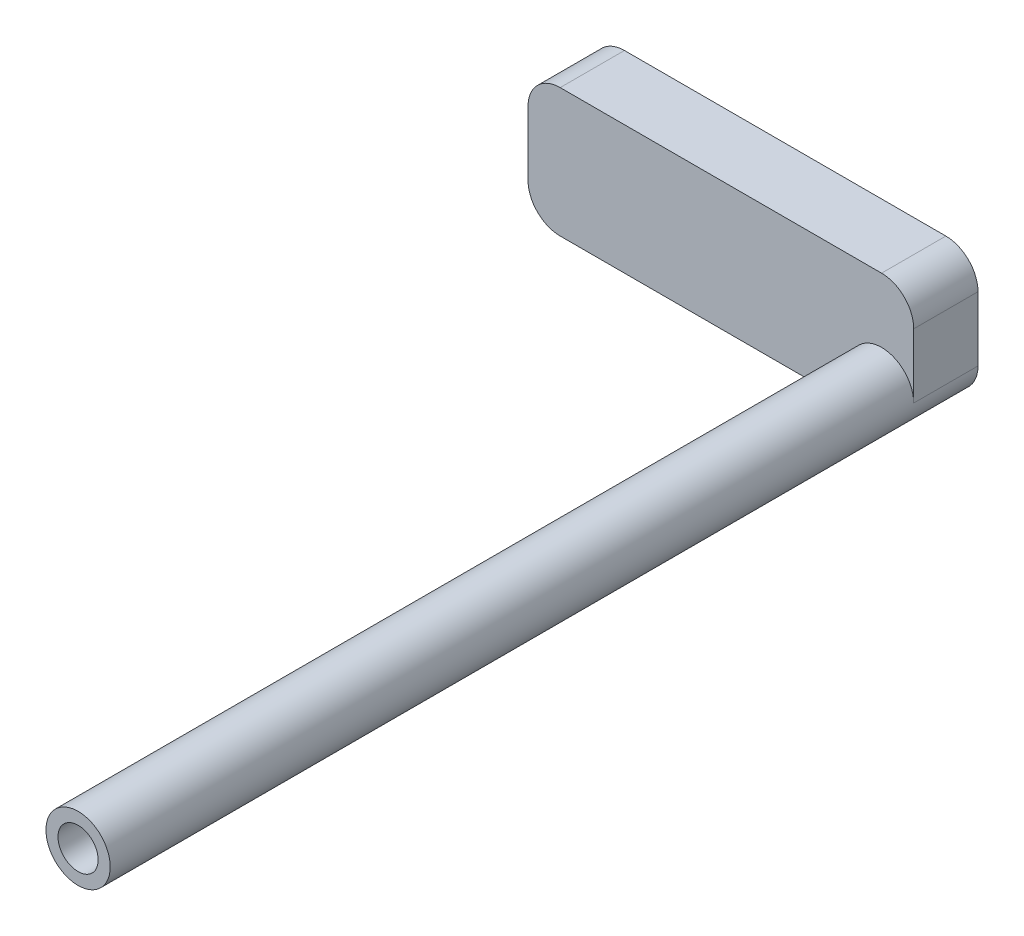
from build123d import *

# Parameters (mm, degrees)
EXTRUDE_1_DEPTH      = 5
EXTRUDE_1_DEPTH_BACK = 100
SKETCH_1_R           = 4
SKETCH_26_R          = 2.5
CUT_EXTRUDE_10_DEPTH = 106.152270541
SKETCH_13_R          = 8.470611641
CUT_EXTRUDE_6_DEPTH  = 5
EXTRUDE_7_DEPTH      = 8
SKETCH_24_R          = 3.2
CUT_EXTRUDE_9_DEPTH  = 3.05


with BuildPart() as part:
    # ｽｹｯﾁ1 → ﾎﾞｽ - 押し出し1 (new, two sides: drawn at the far end of the back side and taken through both)
    with BuildSketch(Plane.XY.offset(-EXTRUDE_1_DEPTH_BACK)):
        Circle(SKETCH_1_R)
    extrude(amount=EXTRUDE_1_DEPTH + EXTRUDE_1_DEPTH_BACK)

    # ｽｹｯﾁ26 → ｶｯﾄ - 押し出し10 (cut, through all)
    with BuildSketch(Plane.XY.offset(5)):
        Circle(SKETCH_26_R)
    extrude(amount=-CUT_EXTRUDE_10_DEPTH, mode=Mode.SUBTRACT)

    # ｽｹｯﾁ13 → ｶｯﾄ - 押し出し6 (cut)
    with BuildSketch(Plane.XY.offset(5)):
        Circle(SKETCH_13_R)
    extrude(amount=-CUT_EXTRUDE_6_DEPTH, mode=Mode.SUBTRACT)

    # ｽｹｯﾁ23 → ﾎﾞｽ - 押し出し7 (add)
    with BuildSketch(Plane(origin=(0, 0, -100), x_dir=(-1, 0, 0), z_dir=(0, 0, -1))):
        with BuildLine():
            Line((-4, 8), (-4, 0))
            ThreePointArc((-4, 0), (-2.828427125, -2.828427125), (0, -4))
            Line((0, -4), (40, -4))
            ThreePointArc((40, -4), (42.828427125, -2.828427125), (44, 0))
            Line((44, 0), (44, 8))
            ThreePointArc((44, 8), (42.828427125, 10.828427125), (40, 12))
            Line((40, 12), (0, 12))
            ThreePointArc((0, 12), (-2.828427125, 10.828427125), (-4, 8))
        make_face()
    extrude(amount=EXTRUDE_7_DEPTH)

    # ｽｹｯﾁ24 → ｶｯﾄ - 押し出し9 (cut)
    with BuildSketch(Plane(origin=(0, 0, -108), x_dir=(-1, 0, 0), z_dir=(0, 0, -1))):
        with Locations((0, 8)):
            Circle(SKETCH_24_R)
        with Locations((40, 8)):
            Circle(SKETCH_24_R)
        with Locations((40, 0)):
            Circle(SKETCH_24_R)
        Circle(SKETCH_24_R)
        with Locations((10, 8)):
            Circle(SKETCH_24_R)
        with Locations((20, 8)):
            Circle(SKETCH_24_R)
        with Locations((30, 8)):
            Circle(SKETCH_24_R)
        with Locations((10, 0)):
            Circle(SKETCH_24_R)
        with Locations((20, 0)):
            Circle(SKETCH_24_R)
        with Locations((30, 0)):
            Circle(SKETCH_24_R)
    extrude(amount=-CUT_EXTRUDE_9_DEPTH, mode=Mode.SUBTRACT)


solid = part.part
